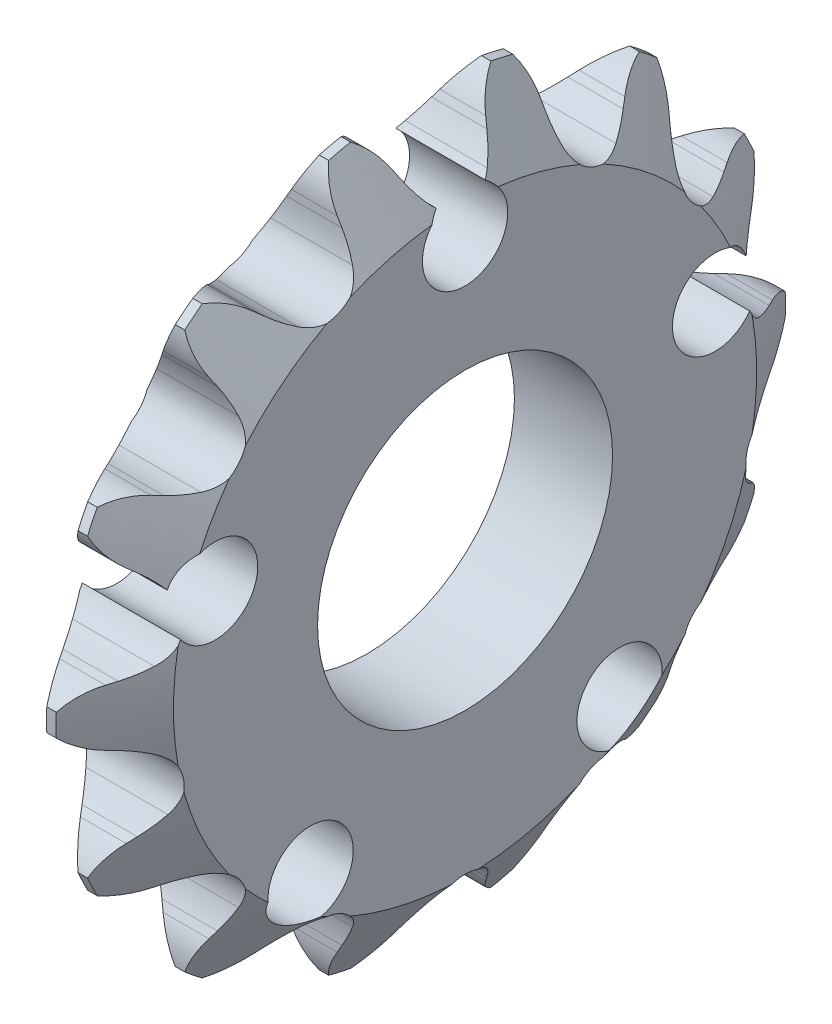
from build123d import *

# Parameters (mm, degrees)
CUT_EXTRUDE1_DEPTH = 23.524793792
CIRPATTERN1_COUNT  = 14
SKETCH4_R          = 6.4135
SKETCH4_R_2        = 1.8542
CUT_EXTRUDE2_DEPTH = 23.621063752


with BuildPart() as part:
    # Sketch2 → Revolve1 (revolve)
    with BuildSketch(Plane.XY):
        Polygon((-0.206375, 15.855820484), (0.206375, 15.855820484), (2.1336, 12.680820484), (2.1336, 0), (-2.1336, 0), (-2.1336, 12.680820484), align=None)
    revolve(axis=Axis((-2.1336, 0, 0), (1, 0, 0)))

    # Sketch3 → Cut-Extrude1 (cut, symmetric)
    with BuildSketch(Plane(origin=(0, 0, 0), x_dir=(0, 0, -1), z_dir=(1, 0, 0))):
        with BuildLine():
            Line((-2.030645468, 14.409414052), (-1.878642309, 14.08764126))
            ThreePointArc((-1.878642309, 14.08764126), (-1.623537626, 13.62333338), (-1.313749559, 13.19357582))
            ThreePointArc((-1.313749559, 13.19357582), (0, 12.570965484), (1.313749559, 13.19357582))
            ThreePointArc((1.313749559, 13.19357582), (1.623537626, 13.62333338), (1.878642309, 14.08764126))
            Line((1.878642309, 14.08764126), (2.030645468, 14.409414052))
            ThreePointArc((2.030645468, 14.409414052), (2.678442811, 15.278504037), (3.612681528, 15.828191966))
            ThreePointArc((3.612681528, 15.828191966), (0, 16.235243415), (-3.612681528, 15.828191966))
            ThreePointArc((-3.612681528, 15.828191966), (-2.678442811, 15.278504037), (-2.030645468, 14.409414052))
        make_face()
    cut_extrude1 = extrude(amount=CUT_EXTRUDE1_DEPTH, both=True, mode=Mode.SUBTRACT)

    # CirPattern1: Cut-Extrude1 ×14 about axis
    cirpattern1_axis = Axis((-88.99, 0, 0), (1, 0, 0))
    for i in range(1, CIRPATTERN1_COUNT):
        add(cut_extrude1.rotate(cirpattern1_axis, i * 360 / CIRPATTERN1_COUNT), mode=Mode.SUBTRACT)

    # Sketch4 → Cut-Extrude2 (cut, through all)
    with BuildSketch(Plane(origin=(2.1336, 0, 0), x_dir=(0, 0, -1), z_dir=(1, 0, 0))):
        Circle(SKETCH4_R)
        with Locations((0, 11.43)):
            Circle(SKETCH4_R_2)
        with Locations((10.870575981, 3.532064246)):
            Circle(SKETCH4_R_2)
        with Locations((6.718385434, -9.247064246)):
            Circle(SKETCH4_R_2)
        with Locations((-6.718385434, -9.247064246)):
            Circle(SKETCH4_R_2)
        with Locations((-10.870575981, 3.532064246)):
            Circle(SKETCH4_R_2)
    extrude(amount=-CUT_EXTRUDE2_DEPTH, mode=Mode.SUBTRACT)


solid = part.part
